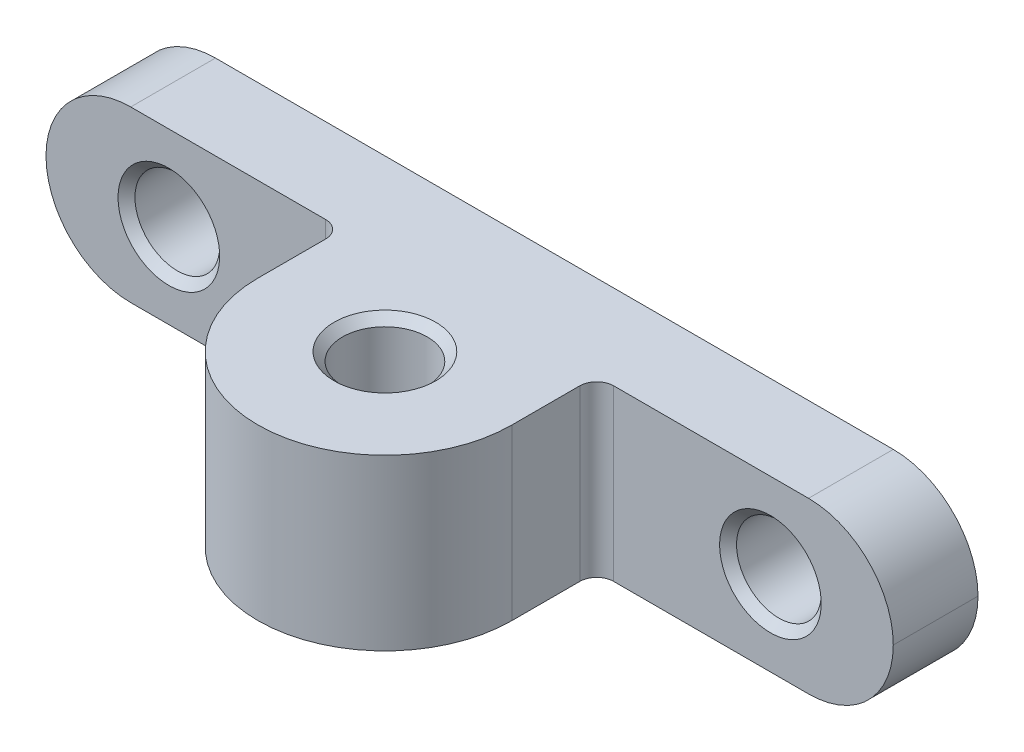
from build123d import *

# Parameters (mm, degrees)
SKETCH1_R               = 1.27
BOSS_EXTRUDE1_DEPTH     = 5.08
FILLET1_R               = 2.54
CUT_EXTRUDE1_DEPTH      = 16.080414451
CUT_EXTRUDE1_DEPTH_BACK = 16.080414451
SKETCH2_R               = 1.27
CHAMFER1_SIZE           = 0.254
FILLET2_R               = 0.508


with BuildPart() as part:
    # Sketch1 → Boss-Extrude1 (new body)
    with BuildSketch(Plane(origin=(0, 0, 0), x_dir=(1, 0, 0), z_dir=(0, 1, 0))):
        with BuildLine():
            Line((-12.7, 5.08), (12.7, 5.08))
            Line((12.7, 5.08), (12.7, 2.54))
            Line((12.7, 2.54), (3.81, 2.54))
            Line((3.81, 2.54), (3.81, 0))
            ThreePointArc((3.81, 0), (0, -3.81), (-3.81, 0))
            Line((-3.81, 0), (-3.81, 2.54))
            Line((-3.81, 2.54), (-12.7, 2.54))
            Line((-12.7, 2.54), (-12.7, 5.08))
        make_face()
        with Locations(Location((0, 0, 0), (0, 0, 270))):
            Circle(SKETCH1_R, mode=Mode.SUBTRACT)
    extrude(amount=BOSS_EXTRUDE1_DEPTH)

    # Fillet1
    fillet1_edges = [part.edges().sort_by_distance(p)[0] for p in [
        (-12.7, 5.08, -3.81),
        (-12.7, 0, -3.81),
        (12.7, 5.08, -3.81),
        (12.7, 0, -3.81),
    ]]
    fillet(fillet1_edges, radius=FILLET1_R - 0.0001)  # a hair under: the kernel refuses the full size

    # Sketch2 → Cut-Extrude1 (cut, two sides: drawn at the far end of the back side and taken through both)
    with BuildSketch(Plane.XY.offset(-2.54).offset(-CUT_EXTRUDE1_DEPTH_BACK)):
        with Locations((-9.017, 2.54)):
            Circle(SKETCH2_R)
        with Locations((9.017, 2.54)):
            Circle(SKETCH2_R)
    extrude(amount=CUT_EXTRUDE1_DEPTH + CUT_EXTRUDE1_DEPTH_BACK, mode=Mode.SUBTRACT)

    # Chamfer1
    chamfer1_edges = [part.edges().sort_by_distance(p)[0] for p in [
        (0, 0, -1.27),
        (0, 5.08, -1.27),
        (-10.287, 2.54, -2.54),
        (7.747, 2.54, -2.54),
    ]]
    chamfer(chamfer1_edges, length=CHAMFER1_SIZE)

    # Fillet2
    fillet2_edges = [part.edges().sort_by_distance(p)[0] for p in [
        (3.81, 2.54, -2.54),
        (-3.81, 2.54, -2.54),
    ]]
    fillet(fillet2_edges, radius=FILLET2_R)


solid = part.part
